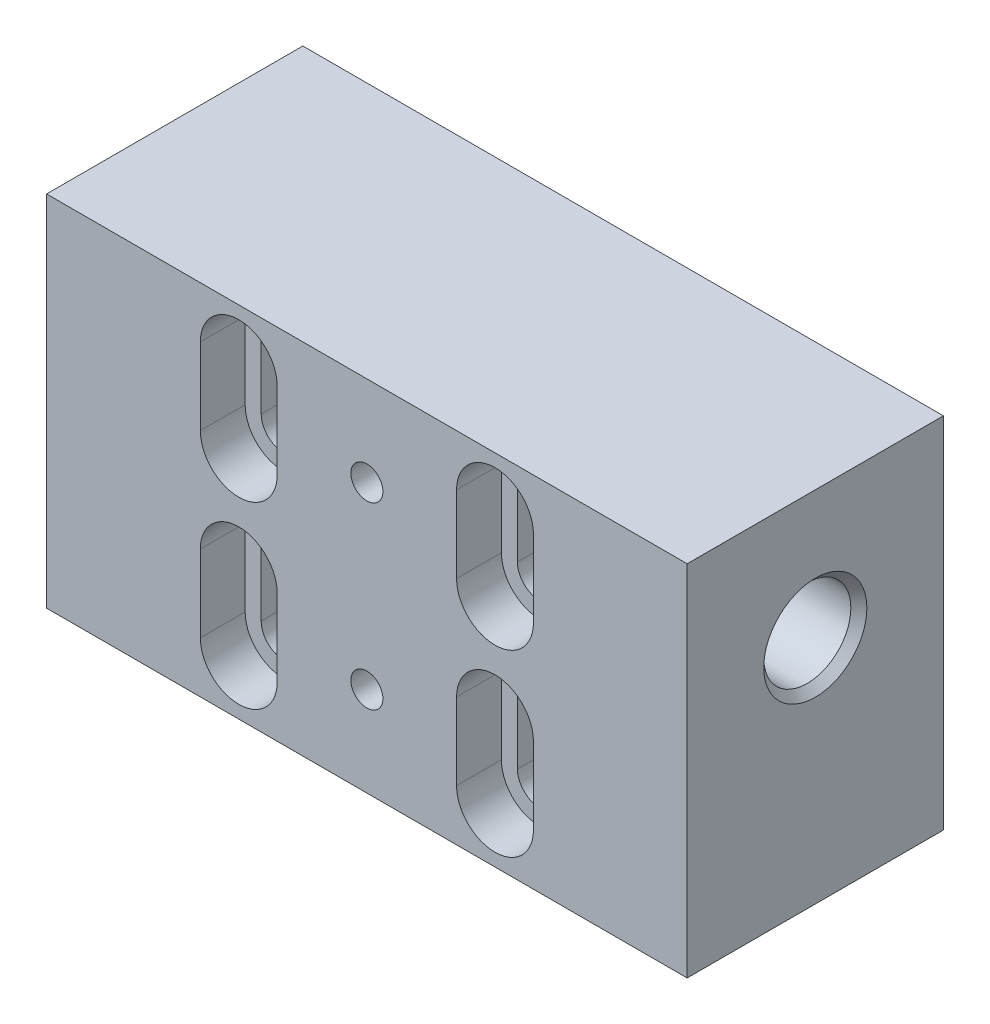
from build123d import *

# Parameters (mm, degrees)
SKETCH1_W             = 50
SKETCH1_H             = 14
BOSS_EXTRUDE1_DEPTH   = 20
CUT_EXTRUDE1_DEPTH    = 3.5
CUT_EXTRUDE2_DEPTH    = 31.761176831
M3X0_5_TAPPED_HOLE1_D = 2.5
MIRROR1_OUTLINE_W     = 50
MIRROR1_OUTLINE_H     = 14
MIRROR1_OUTLINE_R     = 1.25
MIRROR1_DEPTH         = 20
MIRROR1_2_DEPTH       = 16.5


# Read off the part's stored shape, not the designer's step: Mirror1
with BuildPart() as part:
    # Sketch1 → Boss-Extrude1 (new body)
    with BuildSketch(Plane.XY):
        Rectangle(SKETCH1_W, SKETCH1_H)
    extrude(amount=BOSS_EXTRUDE1_DEPTH)

    # Sketch2 → Cut-Extrude1 (cut)
    with BuildSketch(Plane.XY.offset(20)):
        with BuildLine():
            Line((-7, 3), (-7, -3))
            ThreePointArc((-7, -3), (-10, -6), (-13, -3))
            Line((-13, -3), (-13, 3))
            ThreePointArc((-13, 3), (-10, 6), (-7, 3))
        make_face()
        with BuildLine():
            Line((13, 3), (13, -3))
            ThreePointArc((13, -3), (10, -6), (7, -3))
            Line((7, -3), (7, 3))
            ThreePointArc((7, 3), (10, 6), (13, 3))
        make_face()
    extrude(amount=-CUT_EXTRUDE1_DEPTH, mode=Mode.SUBTRACT)

    # Sketch3 → Cut-Extrude2 (cut, through all)
    with BuildSketch(Plane.XY.offset(16.5)):
        with BuildLine():
            Line((-11.75, 3), (-11.75, -3))
            ThreePointArc((-11.75, -3), (-10, -4.75), (-8.25, -3))
            Line((-8.25, -3), (-8.25, 3))
            ThreePointArc((-8.25, 3), (-10, 4.75), (-11.75, 3))
        make_face()
        with BuildLine():
            Line((11.75, -3), (11.75, 3))
            ThreePointArc((11.75, 3), (10, 4.75), (8.25, 3))
            Line((8.25, 3), (8.25, -3))
            ThreePointArc((8.25, -3), (10, -4.75), (11.75, -3))
        make_face()
    extrude(amount=-CUT_EXTRUDE2_DEPTH, mode=Mode.SUBTRACT)

    # M3x0.5 Tapped Hole1 (through all)
    with Locations(Plane.XY.offset(20)):
        with Locations((0, 0)):
            Hole(M3X0_5_TAPPED_HOLE1_D / 2)

    # Mirror1 outline → Mirror1 (add)
    with BuildSketch(Plane.XY):
        with Locations((0, 14)):
            Rectangle(MIRROR1_OUTLINE_W, MIRROR1_OUTLINE_H)
        with BuildLine():
            ThreePointArc((-13, 17), (-10, 20), (-7, 17))
            Line((-7, 17), (-7, 11))
            ThreePointArc((-7, 11), (-10, 8), (-13, 11))
            Line((-13, 11), (-13, 17))
        make_face(mode=Mode.SUBTRACT)
        with Locations((0, 14)):
            Circle(MIRROR1_OUTLINE_R, mode=Mode.SUBTRACT)
        with BuildLine():
            ThreePointArc((7, 17), (10, 20), (13, 17))
            Line((13, 17), (13, 11))
            ThreePointArc((13, 11), (10, 8), (7, 11))
            Line((7, 11), (7, 17))
        make_face(mode=Mode.SUBTRACT)
    extrude(amount=MIRROR1_DEPTH)

    # Mirror1 2 outline → Mirror1 2 (add)
    # profile 1 of 2: a face of its own
    with BuildSketch(Plane.XY):
        with BuildLine():
            Line((13, 11), (13, 17))
            ThreePointArc((13, 17), (10, 20), (7, 17))
            Line((7, 17), (7, 11))
            ThreePointArc((7, 11), (10, 8), (13, 11))
        make_face()
        with BuildLine():
            ThreePointArc((11.75, 11), (10, 9.25), (8.25, 11))
            Line((8.25, 11), (8.25, 17))
            ThreePointArc((8.25, 17), (10, 18.75), (11.75, 17))
            Line((11.75, 17), (11.75, 11))
        make_face(mode=Mode.SUBTRACT)
    # profile 2 of 2: a face of its own
    with BuildSketch(Plane.XY):
        with BuildLine():
            Line((-7, 11), (-7, 17))
            ThreePointArc((-7, 17), (-10, 20), (-13, 17))
            Line((-13, 17), (-13, 11))
            ThreePointArc((-13, 11), (-10, 8), (-7, 11))
        make_face()
        with BuildLine():
            ThreePointArc((-11.75, 17), (-10, 18.75), (-8.25, 17))
            Line((-8.25, 17), (-8.25, 11))
            ThreePointArc((-8.25, 11), (-10, 9.25), (-11.75, 11))
            Line((-11.75, 11), (-11.75, 17))
        make_face(mode=Mode.SUBTRACT)
    extrude(amount=MIRROR1_2_DEPTH)

    # Sketch10 → M8x1.25 Tapped Hole1 (revolve, cut)
    with BuildSketch(Plane(origin=(25, 11, 10), x_dir=(0, 0, -1), z_dir=(0, 1, 0))):
        Polygon((0, 0), (0, 9.75), (3.4, 7.707073895), (3.4, 0.625), (4.025, 0), align=None)
    m8x1_25_tapped_hole1 = revolve(axis=Axis((31.35, 11, 10), (-1, 0, 0)), mode=Mode.SUBTRACT)

    # Mirror2: M8x1.25 Tapped Hole1 across plane
    add(m8x1_25_tapped_hole1.mirror(Plane(origin=(0, 0, 0), x_dir=(0, 0, 1), z_dir=(1, 0, 0))), mode=Mode.SUBTRACT)


solid = part.part
